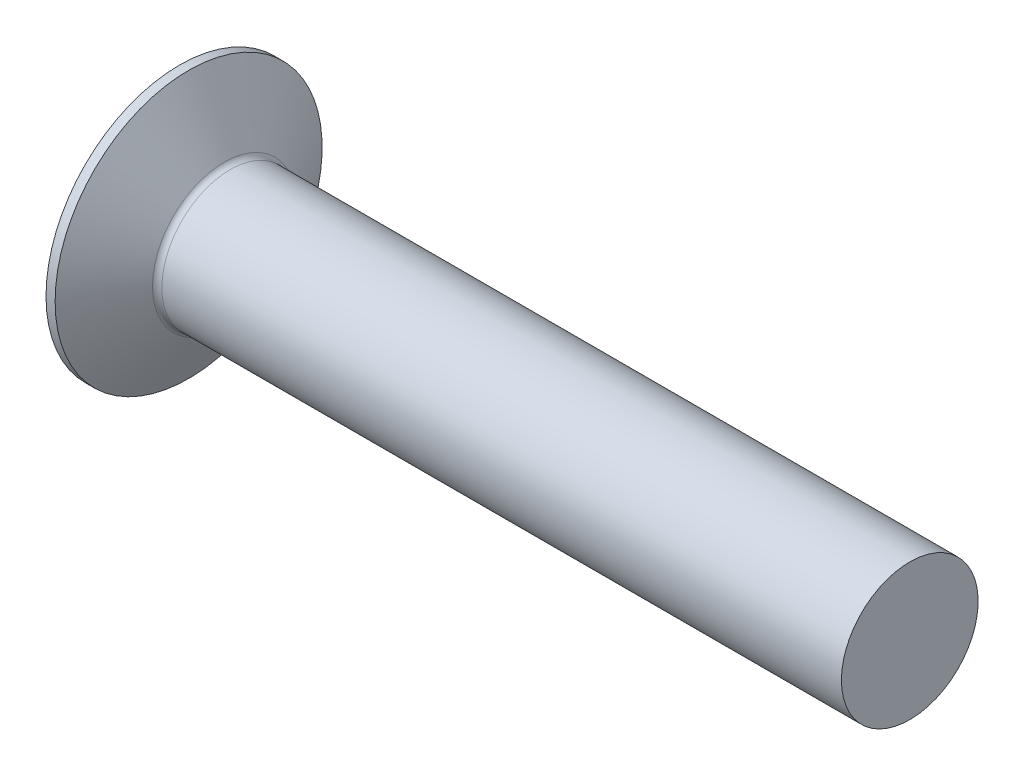
from build123d import *


with BuildPart() as part:
    # Sketch1 → Base-Revolve (revolve)
    with BuildSketch(Plane.XY):
        with BuildLine():
            Line((32.977472851, 0), (32.977472851, 3))
            Line((32.977472851, 3), (3.150677931, 3))
            ThreePointArc((3.150677931, 3), (3.000677931, 3.040192379), (2.89087031, 3.15))
            Line((2.89087031, 3.15), (1.326251081, 5.86))
            Line((1.326251081, 5.86), (0.926251081, 5.86))
            ThreePointArc((0.926251081, 5.86), (0.232991322, 2.96637578), (0, 0))
            Line((0, 0), (32.977472851, 0))
        make_face()
    revolve(axis=Axis((-58.143296089, 0, 0), (1, 0, 0)))


solid = part.part
